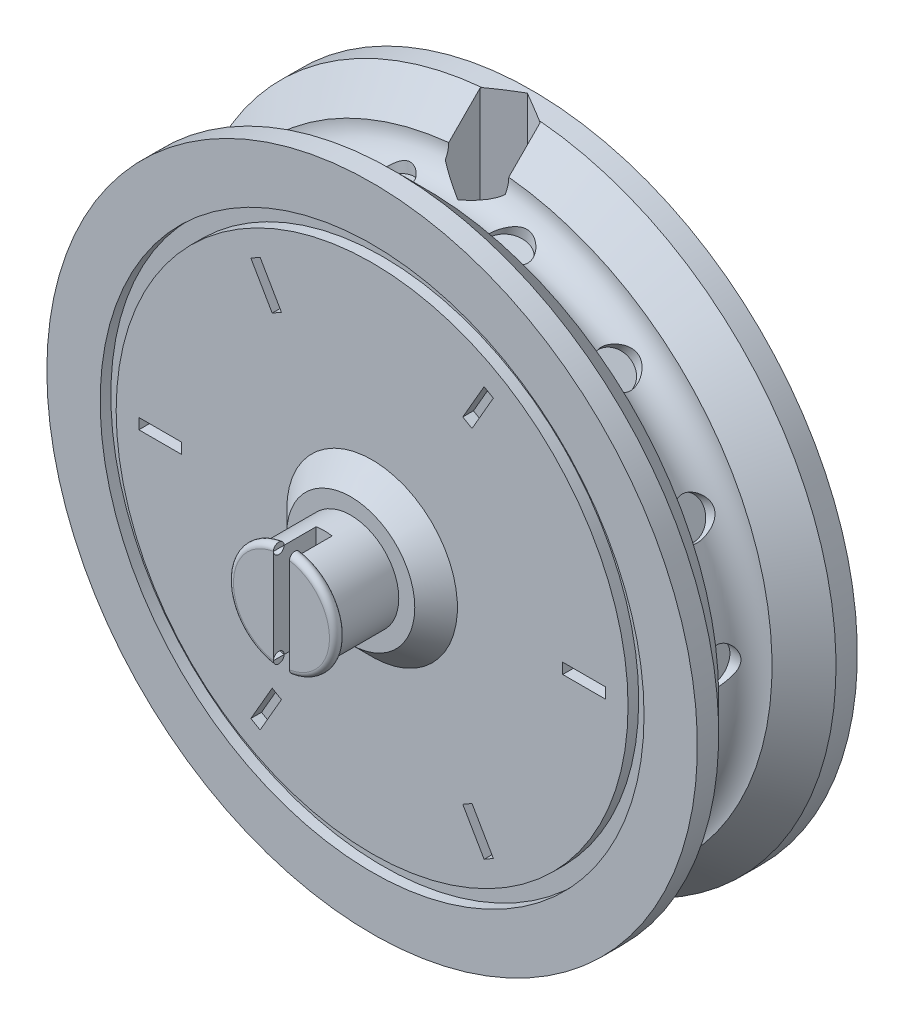
from build123d import *

# Parameters (mm, degrees)
SALIENTE_EXTRUIR1_DEPTH    = 7.7
CORTAR_EXTRUIR1_DEPTH      = 19.533842919
CORTAR_EXTRUIR1_DEPTH_BACK = 19.533842919
CROQUIS3_R                 = 1.65
CROQUIS5_R                 = 2.6
CORTAR_EXTRUIR2_DEPTH      = 48.357153631
CORTAR_EXTRUIR3_DEPTH      = 44.815408405
CROQUIS7_R                 = 6
SALIENTE_EXTRUIR2_DEPTH    = 2
CROQUIS8_R                 = 4.5
SALIENTE_EXTRUIR3_DEPTH    = 5.5
CHAFL_N1_SIZE              = 2
CROQUIS10_W                = 1.5
CROQUIS10_H                = 10
CORTAR_EXTRUIR6_DEPTH      = 4
CORTAR_EXTRUIR7_DEPTH      = 8
CROQUIS15_R                = 25.5
CROQUIS15_R_2              = 24
CORTAR_EXTRUIR8_DEPTH      = 1
CROQUIS16_R                = 1.75
CORTAR_EXTRUIR10_DEPTH     = 6
MATRIZC1_COUNT             = 14
CROQUIS17_W                = 4
CROQUIS17_H                = 1
CORTAR_EXTRUIR11_DEPTH     = 1
MATRIZC2_COUNT             = 6


with BuildPart() as part:
    # Croquis2 → Saliente-Extruir1 (new body)
    with BuildSketch(Plane.XY.offset(-7.7)):
        Polygon((-8.42931393, 0), (-4.214656965, -7.3), (4.214656965, -7.3), (8.42931393, 0), (4.214656965, 7.3), (-4.214656965, 7.3), align=None)
        Polygon((-3.059956427, -5.3), (3.059956427, -5.3), (6.119912853, 0), (3.059956427, 5.3), (-3.059956427, 5.3), (-6.119912853, 0), align=None, mode=Mode.SUBTRACT)
    extrude(amount=SALIENTE_EXTRUIR1_DEPTH)

    # Croquis3 → Cortar-Extruir1 (cut, two sides: drawn at the far end of the back side and taken through both)
    with BuildSketch(Plane.XZ.offset(7.3).offset(-CORTAR_EXTRUIR1_DEPTH_BACK)):
        with Locations(Location((0, -4, 0), (0, 0, 90))):
            Circle(CROQUIS3_R)
    extrude(amount=CORTAR_EXTRUIR1_DEPTH + CORTAR_EXTRUIR1_DEPTH_BACK, mode=Mode.SUBTRACT)

    # Croquis4 → Revolución1 (revolve)
    with BuildSketch(Plane(origin=(0, 0, 0), x_dir=(1, 0, 0), z_dir=(0, 1, 0)), mode=Mode.PRIVATE) as revoluci_n1_sk:
        with BuildLine():
            Line((0, 7.7), (0, -7.3))
            Line((0, -7.3), (30.5, -7.3))
            Line((30.5, -7.3), (30.5, -5.3))
            Line((30.5, -5.3), (27.5, -2.3))
            ThreePointArc((27.5, -2.3), (25, 0.2), (27.5, 2.7))
            Line((27.5, 2.7), (30.5, 5.7))
            Line((30.5, 5.7), (30.5, 7.7))
            Line((30.5, 7.7), (0, 7.7))
        make_face()
    revolve(revoluci_n1_sk.sketch.rotate(Axis((0, 0, -7.7), (0, 0, 1)), 180), axis=Axis((0, 0, -7.7), (0, 0, 1)))

    # Croquis5 → Cortar-Extruir2 (cut, through all)
    with BuildSketch(Plane(origin=(0, 4.9, 0), x_dir=(1, 0, 0), z_dir=(0, 1, 0))):
        with Locations(Location((0, 4, 0), (0, 0, 270))):
            Circle(CROQUIS5_R)
    extrude(amount=-CORTAR_EXTRUIR2_DEPTH, mode=Mode.SUBTRACT)

    # Croquis6 → Cortar-Extruir3 (cut, through all)
    with BuildSketch(Plane(origin=(0, 0, 0), x_dir=(1, 0, 0), z_dir=(0, 1, 0))):
        Polygon((0, 0.75), (2.814582562, 2.375), (2.814582562, 5.625), (0, 7.25), (-2.814582562, 5.625), (-2.814582562, 2.375), align=None)
    extrude(amount=CORTAR_EXTRUIR3_DEPTH, mode=Mode.SUBTRACT)

    # Croquis7 → Saliente-Extruir2 (add)
    with BuildSketch(Plane.XY.offset(7.3)):
        Circle(CROQUIS7_R)
    extrude(amount=SALIENTE_EXTRUIR2_DEPTH)

    # Croquis8 → Saliente-Extruir3 (add)
    with BuildSketch(Plane.XY.offset(9.3)):
        Circle(CROQUIS8_R)
    extrude(amount=SALIENTE_EXTRUIR3_DEPTH)

    # Chaflán1
    chafl_n1_edges = [part.edges().sort_by_distance(p)[0] for p in [
        (-6, 0, 7.3),
    ]]
    chamfer(chafl_n1_edges, length=CHAFL_N1_SIZE - 0.0001)  # a hair under: the kernel refuses the full size

    # Croquis9 → Revolución2 (revolve)
    with BuildSketch(Plane(origin=(0, 0, 0), x_dir=(1, 0, 0), z_dir=(0, 1, 0))):
        with BuildLine():
            Line((0, -14.8), (-4.5, -14.8))
            ThreePointArc((-4.5, -14.8), (-4.146446609, -14.946446609), (-4, -15.3))
            ThreePointArc((-4, -15.3), (-4.146446609, -15.653553391), (-4.5, -15.8))
            Line((-4.5, -15.8), (0, -15.8))
            Line((0, -15.8), (0, -14.8))
        make_face()
        with BuildLine():
            Line((-4.5, -15.3), (-4.5, -14.8))
            ThreePointArc((-4.5, -14.8), (-5, -15.3), (-4.5, -15.8))
            Line((-4.5, -15.8), (-4.5, -15.3))
        make_face()
    revolve(axis=Axis((0, 0, 14.8), (0, 0, 1)))

    # Croquis10 → Cortar-Extruir6 (cut)
    with BuildSketch(Plane.XY.offset(15.8)):
        Rectangle(CROQUIS10_W, CROQUIS10_H)
    extrude(amount=-CORTAR_EXTRUIR6_DEPTH, mode=Mode.SUBTRACT)

    # Croquis12 → Cortar-Extruir7 (cut)
    with BuildSketch(Plane(origin=(0, 0, -7.7), x_dir=(-1, 0, 0), z_dir=(0, 0, -1))):
        Polygon((6.119912853, 0), (3.059956427, 5.3), (-3.059956427, 5.3), (-6.119912853, 0), (-3.059956427, -5.3), (3.059956427, -5.3), align=None)
    extrude(amount=-CORTAR_EXTRUIR7_DEPTH, mode=Mode.SUBTRACT)

    # Croquis15 → Cortar-Extruir8 (cut)
    with BuildSketch(Plane.XY.offset(7.3)):
        Circle(CROQUIS15_R)
        Circle(CROQUIS15_R_2, mode=Mode.SUBTRACT)
    extrude(amount=-CORTAR_EXTRUIR8_DEPTH, mode=Mode.SUBTRACT)

    # Croquis16 → Cortar-Extruir10 (cut)
    with BuildSketch(Plane(origin=(30.5, 0, 0), x_dir=(0, 0, -1), z_dir=(1, 0, 0))):
        with Locations(Location((0, 0, 0), (0, 0, 90))):
            Circle(CROQUIS16_R)
    cortar_extruir10 = extrude(amount=-CORTAR_EXTRUIR10_DEPTH, mode=Mode.SUBTRACT)

    # MatrizC1: Cortar-Extruir10 ×14 about axis
    matrizc1_axis = Axis((0, 0, 0), (0, 0, 1))
    for i in range(1, MATRIZC1_COUNT):
        add(cortar_extruir10.rotate(matrizc1_axis, i * 360 / MATRIZC1_COUNT), mode=Mode.SUBTRACT)

    # Croquis17 → Cortar-Extruir11 (cut)
    with BuildSketch(Plane.XY.offset(7.3)):
        with Locations((19.870465208, 0)):
            Rectangle(CROQUIS17_W, CROQUIS17_H)
    cortar_extruir11 = extrude(amount=-CORTAR_EXTRUIR11_DEPTH, mode=Mode.SUBTRACT)

    # MatrizC2: Cortar-Extruir11 ×6 about axis
    matrizc2_axis = Axis((0, 0, 0), (0, 0, 1))
    for i in range(1, MATRIZC2_COUNT):
        add(cortar_extruir11.rotate(matrizc2_axis, i * 360 / MATRIZC2_COUNT), mode=Mode.SUBTRACT)


solid = part.part
